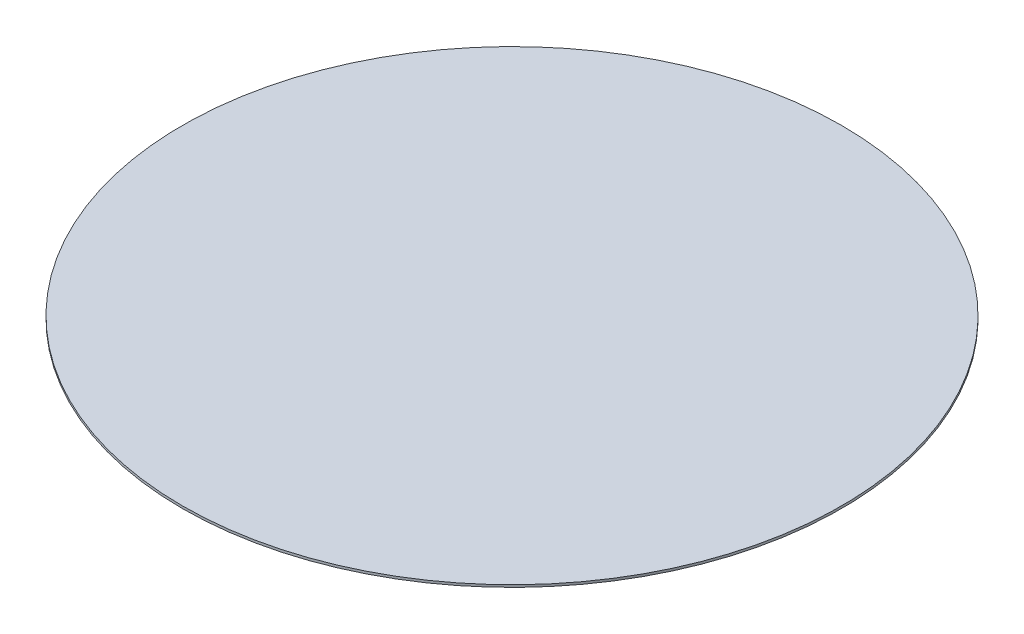
from build123d import *

# Parameters (mm, degrees)
SKETCH1_R           = 140
BOSS_EXTRUDE1_DEPTH = 1


with BuildPart() as part:
    # Sketch1 → Boss-Extrude1 (new body)
    with BuildSketch(Plane(origin=(0, 0, 0), x_dir=(1, 0, 0), z_dir=(0, 1, 0))):
        Circle(SKETCH1_R)
    extrude(amount=BOSS_EXTRUDE1_DEPTH)


solid = part.part
